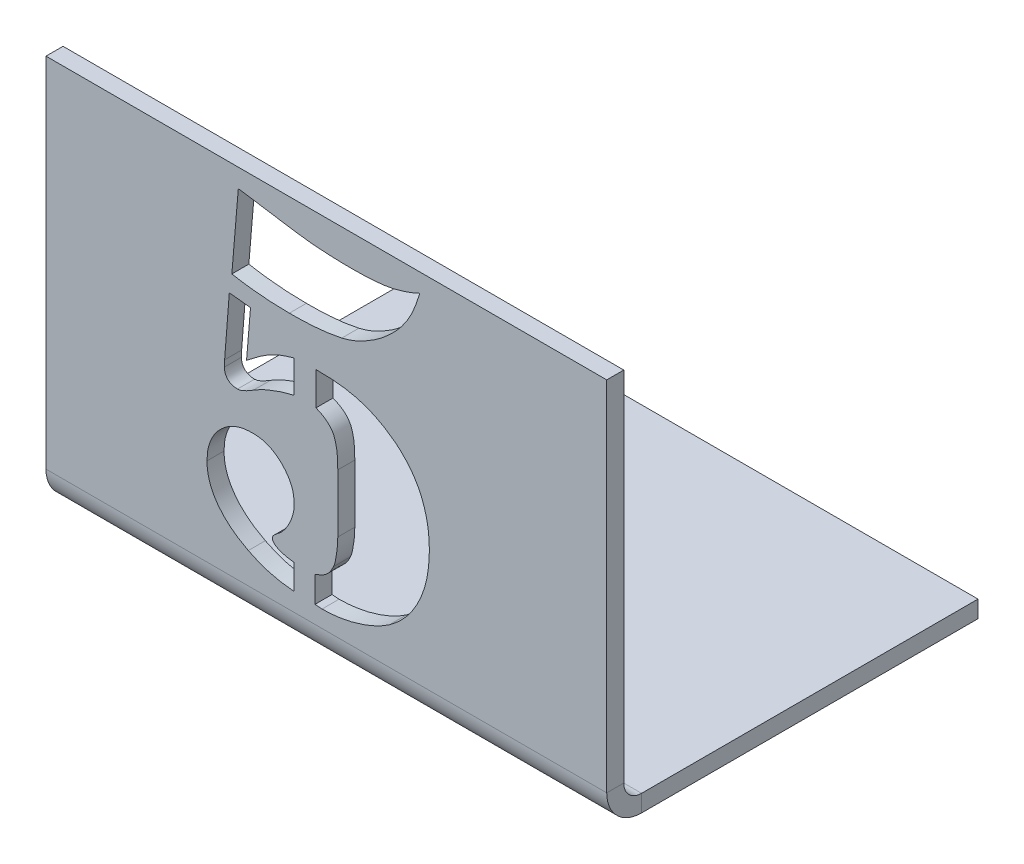
from build123d import *

# Parameters (mm, degrees)
SKETCH1_W            = 50
SKETCH1_H            = 30
BASE_FLANGE1_DEPTH   = 1.51892
EDGE_FLANGE1_DEPTH   = 50
M8_CLEARANCE_HOLE1_D = 9
CUT_EXTRUDE1_DEPTH   = 55.277389816


# Sheet-metal steps are written as plain solids
with BuildPart() as part:
    # Sketch1 → Base-Flange1 (new body)
    with BuildSketch(Plane(origin=(0, 0, 0), x_dir=(1, 0, 0), z_dir=(0, 1, 0))):
        with Locations((0, 15)):
            Rectangle(SKETCH1_W, SKETCH1_H)
    extrude(amount=BASE_FLANGE1_DEPTH)

    # Edge-Flange1 section (across the edge) → Edge-Flange1 (add)
    with BuildSketch(Plane(origin=(-25, 1.51892, 1.5875), x_dir=(0, 0, -1), z_dir=(1, 0, 0))):
        with BuildLine():
            Line((-1.51892, 1.5875), (-1.51892, 33.48108))
            Line((-1.51892, 33.48108), (0, 33.48108))
            Line((0, 33.48108), (0, 1.5875))
            ThreePointArc((0, 1.5875), (0.464967985, 0.464967985), (1.5875, 0))
            Line((1.5875, 0), (1.5875, -1.51892))
            ThreePointArc((1.5875, -1.51892), (-0.609070647, -0.609070647), (-1.51892, 1.5875))
        make_face()
    extrude(amount=EDGE_FLANGE1_DEPTH)

    # M8 Clearance Hole1 (through all)
    with Locations(Plane(origin=(0, 1.51892, 0), x_dir=(1, 0, 0), z_dir=(0, 1, 0))):
        with Locations((-13, 21.89358)):
            Hole(M8_CLEARANCE_HOLE1_D / 2)

    # Sketch11 → Cut-Extrude1 (cut, through all)
    with BuildSketch(Plane.XY.offset(3.10642)):
        with BuildLine():
            Line((-8.429434402, 26.461805556), (-7.852177458, 33.346354167))
            add(Edge.make_bspline(
                [(-7.852177458, 33.346354167), (-7.750816154, 33.332758145), (-7.570235446, 33.308536089), (-7.335950768, 33.269737662), (-7.16908579, 33.248129795), (-7.082457844, 33.231164521), (-7.050094125, 33.224826389)],
                knots=[0, 0, 0, 0, 1.512511488, 2.694621977, 3.512318028, 4, 4, 4, 4], degree=3))
            Line((-7.050094125, 33.224826389), (-2.912073291, 32.580729167))
            add(Edge.make_bspline(
                [(-2.912073291, 32.580729167), (-2.527722876, 32.523946152), (-1.726933625, 32.405639456), (-0.464727653, 32.304554888), (0.901096729, 32.235859209), (1.847664098, 32.226875316), (2.337926709, 32.222222222)],
                knots=[0, 0, 0, 0, 0.884904639, 1.843687673, 2.883165271, 4, 4, 4, 4], degree=3))
            add(Edge.make_bspline(
                [(2.337926709, 32.222222222), (2.664115591, 32.223052691), (3.284501151, 32.224632177), (4.16395745, 32.276494633), (4.947096314, 32.345473817), (5.652081858, 32.448700661), (6.316662875, 32.598146088), (6.972968143, 32.805172465), (7.651747383, 33.043871147), (8.099652585, 33.243847478), (8.329246153, 33.346354167)],
                knots=[0, 0, 0, 0, 1.271882916, 2.419021123, 3.434563156, 4.337227075, 5.195745204, 6.087804927, 7.019820069, 8, 8, 8, 8], degree=3))
            add(Edge.make_bspline(
                [(8.329246153, 33.346354167), (8.259003294, 33.11454763), (8.124804889, 32.671683152), (7.888867489, 32.046801399), (7.652746793, 31.48349556), (7.388054466, 30.978420386), (7.103908442, 30.501243307), (6.763827222, 30.041322475), (6.383725288, 29.569973605), (6.095555882, 29.271000065), (5.947301709, 29.1171875)],
                knots=[0, 0, 0, 0, 1.18301964, 2.260149273, 3.261961199, 4.164856873, 5.043958308, 5.972307709, 6.956815542, 8, 8, 8, 8], degree=3))
            add(Edge.make_bspline(
                [(5.947301709, 29.1171875), (5.78113827, 28.95507414), (5.448242878, 28.630292765), (4.915187193, 28.182349072), (4.350729736, 27.773425409), (3.769234519, 27.400689247), (3.175424003, 27.071698164), (2.578335806, 26.797647538), (1.981900818, 26.574304809), (1.577404536, 26.470486688), (1.377857264, 26.419270833)],
                knots=[0, 0, 0, 0, 1.036648048, 2.076842897, 3.106479929, 4.147972246, 5.160253363, 6.13584969, 7.080372, 8, 8, 8, 8], degree=3))
            add(Edge.make_bspline(
                [(1.377857264, 26.419270833), (1.056542795, 26.354060763), (0.371180449, 26.21496797), (-0.734052761, 26.090349084), (-1.973062002, 26.010266673), (-2.843054372, 26.003540318), (-3.30096218, 26)],
                knots=[0, 0, 0, 0, 0.835576042, 1.782280012, 2.832735397, 4, 4, 4, 4], degree=3))
            add(Edge.make_bspline(
                [(-3.30096218, 26), (-3.734551037, 26.0062381), (-4.59647351, 26.018638692), (-5.886061594, 26.106344439), (-7.163721213, 26.249076643), (-8.008701379, 26.391092791), (-8.429434402, 26.461805556)],
                knots=[0, 0, 0, 0, 1.009132994, 2.006034964, 3.007163752, 4, 4, 4, 4], degree=3))
        make_face()
        with BuildLine():
            Line((-8.654260791, 24.900173611), (-6.764503847, 24.693576389))
            Line((-6.764503847, 24.693576389), (-7.116934402, 20.446180556))
            add(Edge.make_bspline(
                [(-7.116934402, 20.446180556), (-6.921577738, 20.603560076), (-6.547967063, 20.904541202), (-5.994072027, 21.314282315), (-5.472542497, 21.660718412), (-4.816573106, 22.04916856), (-3.961718225, 22.443568545), (-3.239541226, 22.645614845), (-2.869538569, 22.749131944)],
                knots=[0, 0, 0, 0, 0.925828141, 1.770603931, 2.54189596, 3.235517169, 4.583635321, 6, 6, 6, 6], degree=3))
            Line((-2.869538569, 22.749131944), (-2.869538569, 19.875))
            add(Edge.make_bspline(
                [(-2.869538569, 19.875), (-3.217737492, 19.787884957), (-3.891193043, 19.619394749), (-4.841003688, 19.275331815), (-5.717540324, 18.911537013), (-6.246865958, 18.602696773), (-6.503219125, 18.453125)],
                knots=[0, 0, 0, 0, 1.098632186, 2.124877172, 3.091875316, 4, 4, 4, 4], degree=3))
            add(Edge.make_bspline(
                [(-6.503219125, 18.453125), (-6.653391986, 18.358574794), (-6.924119561, 18.188122238), (-7.315127912, 18.001549703), (-7.632177017, 17.861061339), (-7.833013863, 17.841647062), (-7.919017736, 17.833333333)],
                knots=[0, 0, 0, 0, 1.362623025, 2.45649996, 3.339030746, 4, 4, 4, 4], degree=3))
            add(Edge.make_bspline(
                [(-7.919017736, 17.833333333), (-8.006435338, 17.836301907), (-8.171078318, 17.84189294), (-8.406904551, 17.898452089), (-8.61062664, 17.994792242), (-8.788245899, 18.123836697), (-8.921630988, 18.291628815), (-9.02013291, 18.483632442), (-9.084657423, 18.702265853), (-9.089317643, 18.857732034), (-9.091760791, 18.939236111)],
                knots=[0, 0, 0, 0, 1.149505527, 2.16498748, 3.167074778, 4.100449969, 5.029242275, 5.959564718, 6.930289569, 8, 8, 8, 8], degree=3))
            add(Edge.make_bspline(
                [(-9.091760791, 18.939236111), (-9.090095047, 19.028367763), (-9.086535387, 19.218840209), (-9.078047567, 19.409158102), (-9.073531625, 19.510416667)],
                knots=[0, 0, 0, 0, 0.935900738, 2, 2, 2, 2], degree=3))
            Line((-9.073531625, 19.510416667), (-8.654260791, 24.900173611))
        make_face()
        with BuildLine():
            Line((-0.925094125, 19.875), (-0.925094125, 22.834201389))
            add(Edge.make_bspline(
                [(-0.925094125, 22.834201389), (-0.596865338, 22.831516429), (0.03185898, 22.826373371), (0.934576894, 22.765278217), (1.75486295, 22.665254243), (2.506834072, 22.5184281), (3.208271905, 22.319026885), (3.890366787, 22.078213373), (4.550089199, 21.766317662), (4.974628991, 21.522548618), (5.187753098, 21.400173611)],
                knots=[0, 0, 0, 0, 1.237045902, 2.369569249, 3.408404015, 4.350208742, 5.254212742, 6.155019348, 7.073797411, 8, 8, 8, 8], degree=3))
            add(Edge.make_bspline(
                [(5.187753098, 21.400173611), (5.505717454, 21.19366397), (6.12961024, 20.788461713), (6.947318674, 20.050893181), (7.643210334, 19.234477218), (8.216454443, 18.335072246), (8.645988347, 17.341817903), (8.96334011, 16.273677232), (9.155189153, 15.1200023), (9.175538839, 14.323952321), (9.186016987, 13.9140625)],
                knots=[0, 0, 0, 0, 1.019790482, 2.000978761, 2.95295395, 3.901798457, 4.861617676, 5.857449681, 6.896790918, 8, 8, 8, 8], degree=3))
            add(Edge.make_bspline(
                [(9.186016987, 13.9140625), (9.173725715, 13.518523925), (9.149656168, 12.743955188), (8.979071695, 11.611513929), (8.685630852, 10.541506823), (8.280443539, 9.536333393), (7.761789054, 8.612217693), (7.150745457, 7.769629964), (6.436744119, 7.018498408), (5.888542771, 6.601175799), (5.61310032, 6.391493056)],
                knots=[0, 0, 0, 0, 1.095858961, 2.145980557, 3.164428905, 4.163911529, 5.14132604, 6.093271617, 7.041968902, 8, 8, 8, 8], degree=3))
            add(Edge.make_bspline(
                [(5.61310032, 6.391493056), (5.406757755, 6.257939101), (4.986575347, 5.985978624), (4.303563877, 5.64619589), (3.576205893, 5.337828453), (2.806715351, 5.084292192), (2.017368537, 4.867081418), (1.215569772, 4.725546222), (0.416114906, 4.628537222), (-0.118676766, 4.616894022), (-0.384295513, 4.611111111)],
                knots=[0, 0, 0, 0, 0.929439507, 1.892649394, 2.881974765, 3.916920741, 4.956199957, 5.976971837, 6.995208348, 8, 8, 8, 8], degree=3))
            Line((-0.384295513, 4.611111111), (-1.010163569, 4.659722222))
            Line((-1.010163569, 4.659722222), (-1.010163569, 6.980902778))
            add(Edge.make_bspline(
                [(-1.010163569, 6.980902778), (-0.816660124, 7.050713046), (-0.457457555, 7.180302613), (0.017227276, 7.475778006), (0.385379817, 7.884695762), (0.545573152, 8.215387611), (0.630461431, 8.390625)],
                knots=[0, 0, 0, 0, 1.099256899, 2.040562643, 2.961671761, 4, 4, 4, 4], degree=3))
            add(Edge.make_bspline(
                [(0.630461431, 8.390625), (0.658101026, 8.452913981), (0.720077885, 8.592585904), (0.789791062, 8.835567955), (0.847196916, 9.131174903), (0.928208916, 9.583189626), (0.998815822, 10.170985184), (1.012617806, 10.644762651), (1.01935032, 10.875868056)],
                knots=[0, 0, 0, 0, 0.484596084, 1.086620241, 1.793438744, 2.627692656, 4.35501157, 6, 6, 6, 6], degree=3))
            Line((1.01935032, 10.875868056), (1.01935032, 16.059027778))
            add(Edge.make_bspline(
                [(1.01935032, 16.059027778), (1.015337687, 16.338676982), (1.007935541, 16.854548867), (0.939822576, 17.567561374), (0.816795343, 18.153858273), (0.642530037, 18.637971837), (0.376001777, 19.027794921), (0.030002977, 19.364493478), (-0.409965071, 19.654714378), (-0.748216252, 19.799361377), (-0.925094125, 19.875)],
                knots=[0, 0, 0, 0, 1.443148872, 2.662192195, 3.689429545, 4.529987255, 5.298280431, 6.103991745, 7.008541799, 8, 8, 8, 8], degree=3))
        make_face()
        with BuildLine():
            Line((-2.869538569, 6.956597222), (-2.869538569, 4.720486111))
            add(Edge.make_bspline(
                [(-2.869538569, 4.720486111), (-3.231097117, 4.755898346), (-3.945585789, 4.82587772), (-4.992998316, 5.054636908), (-6.001400564, 5.387489796), (-6.639639273, 5.688131483), (-6.958948291, 5.838541667)],
                knots=[0, 0, 0, 0, 1.020916949, 2.017470201, 3.008145958, 4, 4, 4, 4], degree=3))
            add(Edge.make_bspline(
                [(-6.958948291, 5.838541667), (-7.242140742, 5.992527851), (-7.790747586, 6.290833384), (-8.529861898, 6.824400896), (-9.171634282, 7.402923282), (-9.700120625, 8.036855447), (-10.128576088, 8.707440039), (-10.427082784, 9.418555948), (-10.61192687, 10.159635558), (-10.635458551, 10.664165985), (-10.647316347, 10.918402778)],
                knots=[0, 0, 0, 0, 1.168007279, 2.262690219, 3.297345905, 4.293315058, 5.24711158, 6.172075055, 7.078894453, 8, 8, 8, 8], degree=3))
            add(Edge.make_bspline(
                [(-10.647316347, 10.918402778), (-10.634619423, 11.207634912), (-10.609989768, 11.76869109), (-10.380522404, 12.568799986), (-10.018444561, 13.297775783), (-9.50624558, 13.930378596), (-8.888607501, 14.455048817), (-8.18248195, 14.840069402), (-7.398868476, 15.074020072), (-6.851200486, 15.098529426), (-6.570059402, 15.111111111)],
                knots=[0, 0, 0, 0, 1.060548474, 2.057265438, 3.032439394, 4.033149231, 5.026052515, 5.991809793, 6.969111248, 8, 8, 8, 8], degree=3))
            add(Edge.make_bspline(
                [(-6.570059402, 15.111111111), (-6.325544899, 15.098936782), (-5.846055888, 15.075063117), (-5.153856878, 14.864919662), (-4.518572139, 14.517854958), (-3.955207638, 14.043989553), (-3.479537782, 13.488757675), (-3.119487031, 12.867769789), (-2.905806445, 12.187936828), (-2.881710072, 11.715876542), (-2.869538569, 11.477430556)],
                knots=[0, 0, 0, 0, 1.019624253, 1.999466778, 2.991472704, 4.025010365, 5.057508423, 6.031451208, 7.005651246, 8, 8, 8, 8], degree=3))
            add(Edge.make_bspline(
                [(-2.869538569, 11.477430556), (-2.873916154, 11.339327009), (-2.88280605, 11.058869584), (-2.966929602, 10.636692955), (-3.100896145, 10.208527202), (-3.289927953, 9.789103517), (-3.498719515, 9.383804442), (-3.753033221, 9.032635993), (-4.018279151, 8.71850094), (-4.225764161, 8.551702889), (-4.327871902, 8.469618056)],
                knots=[0, 0, 0, 0, 0.960404233, 1.950366257, 2.984907004, 4.077209864, 5.149585052, 6.151026727, 7.090081326, 8, 8, 8, 8], degree=3))
            add(Edge.make_bspline(
                [(-4.327871902, 8.469618056), (-4.400328574, 8.414497749), (-4.529938823, 8.315898731), (-4.682574764, 8.164188863), (-4.78999569, 8.029573496), (-4.806695582, 7.934046707), (-4.813983013, 7.892361111)],
                knots=[0, 0, 0, 0, 1.407061474, 2.516946802, 3.352831204, 4, 4, 4, 4], degree=3))
            add(Edge.make_bspline(
                [(-4.813983013, 7.892361111), (-4.808718395, 7.835886895), (-4.797923552, 7.720089256), (-4.680466612, 7.568217758), (-4.523367884, 7.419514919), (-4.290001497, 7.297578102), (-4.007416739, 7.183745007), (-3.670883805, 7.088558013), (-3.287065131, 7.009730461), (-3.013654221, 6.974936969), (-2.869538569, 6.956597222)],
                knots=[0, 0, 0, 0, 0.580783967, 1.190869335, 1.939264737, 2.839110825, 3.911359474, 5.122883584, 6.483463917, 8, 8, 8, 8], degree=3))
        make_face()
    extrude(amount=-CUT_EXTRUDE1_DEPTH, mode=Mode.SUBTRACT)


solid = part.part
